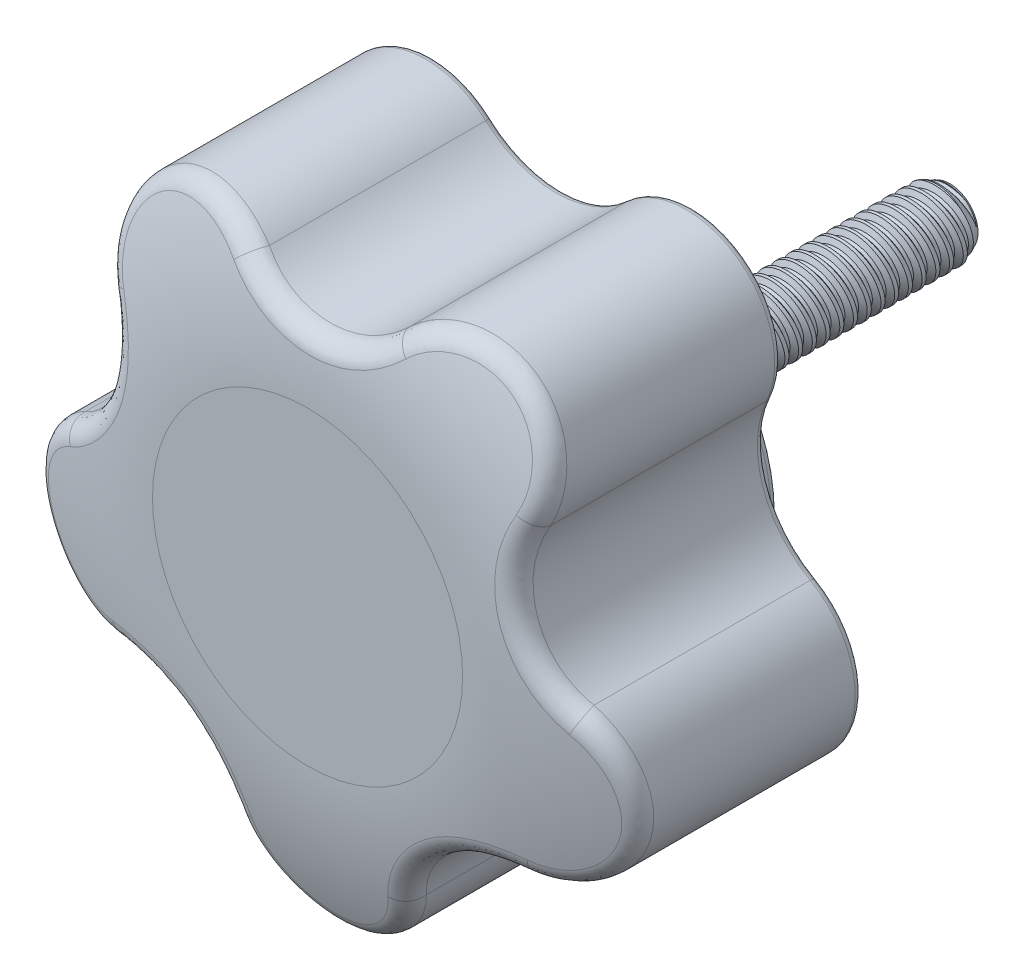
from build123d import *

# Parameters (mm, degrees)
SKETCH1_W            = 31.75
SKETCH1_H            = 3.175
LPATTERN1_COUNT      = 25
LPATTERN1_PITCH      = 1.27
LPATTERN1_COUNT_DIR2 = 2
LPATTERN1_PITCH_DIR2 = 1.27
CUT_EXTRUDE1_DEPTH   = 72.973937754
CIRPATTERN1_COUNT    = 5
FILLET4_R            = 0.635
FILLET5_R            = 1.905


with BuildPart() as part:
    # Sketch1 → Revolve1 (revolve)
    with BuildSketch(Plane(origin=(0, 0, 0), x_dir=(0, 0, -1), z_dir=(1, 0, 0))):
        with Locations((0, 1.5875)):
            Rectangle(SKETCH1_W, SKETCH1_H)
    revolve(axis=Axis((0, 0, 8.5598), (0, 0, 1)))

    # Sketch2 → Cut-Revolve1 (revolve, cut)
    with BuildSketch(Plane(origin=(0, 0, 0), x_dir=(0, 0, -1), z_dir=(1, 0, 0))):
        Polygon((-15.719332818, 3.206133436), (-14.629662542, 3.424067492), (-14.884018763, 2.672175229), (-15.195353128, 2.609908356), align=None)
    cut_revolve1 = revolve(axis=Axis((0, -0.272704483, 15.875), (0, 0.19611613513818427, -0.9805806756909201)), mode=Mode.SUBTRACT)

    # LPattern1: Cut-Revolve1 25 × 2
    with Locations(*[Vector(0, 0, -1) * (i * LPATTERN1_PITCH) + Vector(0, 0, 1) * (j * LPATTERN1_PITCH_DIR2) for i in range(LPATTERN1_COUNT) for j in range(LPATTERN1_COUNT_DIR2) if (i, j) != (0, 0)]):
        add(cut_revolve1, mode=Mode.SUBTRACT)

    # Sketch7 → Cut-Revolve2 (revolve, cut)
    with BuildSketch(Plane(origin=(0, 0, 0), x_dir=(0, 0, -1), z_dir=(1, 0, 0))):
        Polygon((15.875, 2.609908356), (14.663157058, 3.175), (15.875, 3.175), align=None)
    revolve(axis=Axis((0, 0, -28.575), (0, 0, 1)), mode=Mode.SUBTRACT)


with BuildPart() as body_2:
    # Sketch5 → Revolve3 (revolve)
    with BuildSketch(Plane(origin=(0, 0, 0), x_dir=(0, 0, -1), z_dir=(1, 0, 0))):
        Polygon((-15.875, 15.875), (-19.939, 15.875), (-19.939, 28.702), (-43.561, 28.702), (-43.561, 0), (-15.875, 0), align=None)
    revolve(axis=Axis((0, 0, 15.875), (0, 0, -1)))

    # Sketch6 → Cut-Extrude1 (cut, through all)
    with BuildSketch(Plane.XY.offset(43.561)):
        with BuildLine():
            Line((0, 32.698441936), (0, 20.0914))
            ThreePointArc((0, 20.0914), (3.4904024, 20.747285439), (6.504626265, 22.625462511))
            ThreePointArc((6.504626265, 22.625462511), (11.581446239, 24.772838868), (16.870612311, 23.220405773))
            ThreePointArc((16.870612311, 23.220405773), (19.981506125, 18.669838122), (19.508053498, 13.177919617))
            ThreePointArc((19.508053498, 13.177919617), (18.653247353, 9.730833735), (19.108056891, 6.208584041))
            Line((19.108056891, 6.208584041), (31.098066276, 10.104374248))
            ThreePointArc((31.098066276, 10.104374248), (19.219661943, 26.453595216), (0, 32.698441936))
        make_face()
    cut_extrude1 = extrude(amount=-CUT_EXTRUDE1_DEPTH, mode=Mode.SUBTRACT)

    # CirPattern1: Cut-Extrude1 ×5 about axis
    cirpattern1_axis = Axis((0, 0, 0), (0, 0, -1))
    for i in range(1, CIRPATTERN1_COUNT):
        add(cut_extrude1.rotate(cirpattern1_axis, i * 360 / CIRPATTERN1_COUNT), mode=Mode.SUBTRACT)

    # Sketch8 → Cut-Revolve3 (revolve, cut)
    with BuildSketch(Plane(origin=(0, 0, 0), x_dir=(0, 0, -1), z_dir=(1, 0, 0))):
        with BuildLine():
            Line((-40.386, 28.702), (-40.386, 29.972))
            Line((-40.386, 29.972), (-44.831, 29.972))
            Line((-44.831, 29.972), (-44.831, 14.351))
            Line((-44.831, 14.351), (-43.561, 14.351))
            ThreePointArc((-43.561, 14.351), (-42.75776782, 21.70001058), (-40.386, 28.702))
        make_face()
    revolve(axis=Axis((0, 0, 15.875), (0, 0, 1)), mode=Mode.SUBTRACT)

    # Fillet4
    fillet4_edges = [body_2.edges().sort_by_distance(p)[0] for p in [
        (16.870612311, 23.220405773, 19.939),
        (19.108056891, 6.208584041, 19.939),
        (-16.870612311, 23.220405773, 19.939),
        (0, -15.875, 15.875),
        (0, 20.0914, 19.939),
    ]]
    fillet(fillet4_edges, radius=FILLET4_R)

    # Fillet5
    fillet5_edges = [body_2.edges().sort_by_distance(p)[0] for p in [
        (-3.512191924, 20.755804718, 42.894758713),
        (19.108056891, 6.208584042, 43.073207641),
        (16.870612326, 23.220405762, 40.386),
    ]]
    fillet(fillet5_edges, radius=FILLET5_R)

    # Combine1: union part
    add(part.part)


solid = body_2.part
